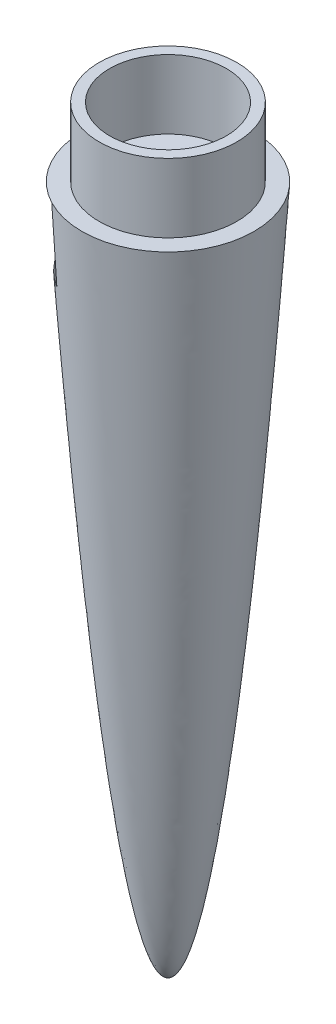
from build123d import *


with BuildPart() as part:
    # Sketch4 → Revolve2 (revolve)
    with BuildSketch(Plane(origin=(0, 0, 0), x_dir=(0, 0, -1), z_dir=(1, 0, 0))):
        with BuildLine():
            Line((-7.937596759, 63.461082229), (-6.35, 63.461082229))
            Line((-6.35, 63.461082229), (-6.35, 69.81108223))
            Line((-6.35, 69.81108223), (-5.382282251, 69.81108223))
            Line((-5.382282251, 69.81108223), (-5.382282251, 63.46108223))
            Line((-5.382282251, 63.46108223), (0, 63.46108223))
            Line((0, 63.46108223), (0, 62.109681546))
            Line((0, 62.109681546), (-6.618429758, 62.109681546))
            add(Edge.make_bspline(
                [(0, 2.142043212), (-0.030142803, 2.14200016), (-0.070984774, 2.146674618), (-0.122234781, 2.16122915), (-0.184754507, 2.190967759), (-0.232886612, 2.220539348), (-0.287272361, 2.26204613), (-0.350964684, 2.321740534), (-0.427459891, 2.408474624), (-0.526345687, 2.545476517), (-0.662083395, 2.776767021), (-0.860485756, 3.206289498), (-1.166702525, 4.072298926), (-1.640339171, 5.912202207), (-2.174718126, 8.817343294), (-2.728236987, 12.692812558), (-3.263291017, 17.249192085), (-3.743960803, 21.976874806), (-4.171958958, 26.666226788), (-4.567813045, 31.427121871), (-4.928868107, 36.079232156), (-5.27790833, 40.914816186), (-5.590973257, 45.453050144), (-5.916704121, 50.484228866), (-6.182003731, 54.703207586), (-6.43019284, 58.874049144), (-6.556413835, 61.034341862), (-6.618429758, 62.109681546)],
                knots=[0, 0, 0, 0, 0, 0.001791567, 0.002467056, 0.003168881, 0.004143242, 0.005173262, 0.006563962, 0.008394638, 0.011072152, 0.015284422, 0.022638725, 0.036701089, 0.066150514, 0.128985989, 0.199980083, 0.270974175, 0.341968268, 0.412962361, 0.483956454, 0.554950548, 0.625944641, 0.696938735, 0.767932828, 0.838926921, 0.909921014, 0.909921014, 0.909921014, 0.909921014, 0.909921014], degree=4))
            Line((0, 2.142043212), (0, 0))
            add(Edge.make_bspline(
                [(0, 0), (-0.036893982, -9.2316e-05), (-0.085651838, 0.004861375), (-0.147159585, 0.020115914), (-0.223876295, 0.052141138), (-0.283528261, 0.08437189), (-0.351903292, 0.130742518), (-0.432243175, 0.198094817), (-0.528081055, 0.295705158), (-0.649619604, 0.447259922), (-0.810122073, 0.693060955), (-1.036803006, 1.129160986), (-1.377699029, 1.971061952), (-1.893557356, 3.685826364), (-2.521273256, 6.548991805), (-3.180530623, 10.479147582), (-3.827902927, 15.203009107), (-4.423842424, 20.284640268), (-4.951956386, 25.327326965), (-5.437985183, 30.446846383), (-5.880391538, 35.452984216), (-6.306550285, 40.652205344), (-6.688767185, 45.540289732), (-7.084715916, 50.945241557), (-7.408349338, 55.499810376), (-7.708516681, 59.969363747), (-7.862332167, 62.303568), (-7.937596759, 63.461082229)],
                knots=[0, 0, 0, 0, 0, 0.002070005, 0.002771214, 0.003558119, 0.004690252, 0.005895102, 0.007432898, 0.009472261, 0.012412914, 0.016849151, 0.024013797, 0.03717915, 0.063736652, 0.117806225, 0.189835435, 0.261864658, 0.333893879, 0.405923101, 0.477952323, 0.549981545, 0.622010767, 0.694039989, 0.766069211, 0.838098433, 0.910127655, 0.910127655, 0.910127655, 0.910127655, 0.910127655], degree=4))
        make_face()
    revolve(axis=Axis((0, -0.03891777, 0), (0, 1, 0)))


solid = part.part
